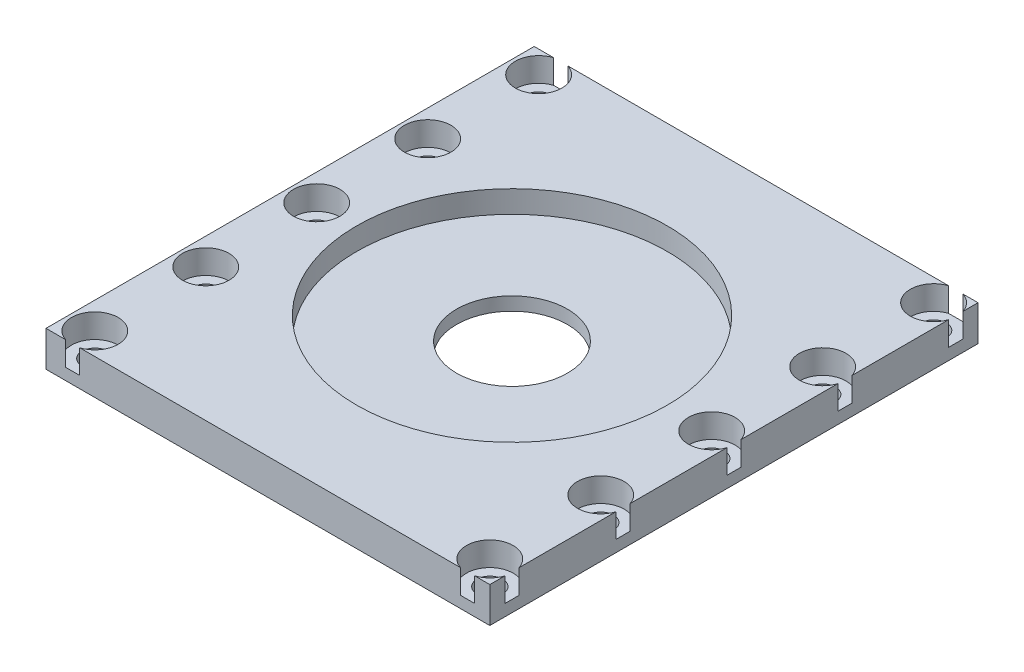
from build123d import *

# Parameters (mm, degrees)
SKETCH1_W                                           = 100
SKETCH1_H                                           = 110
BOSS_EXTRUDE1_DEPTH                                 = 8
CBORE_FOR_M5_HEX_SOCKET_HEAD_CAP_SCREW3_D           = 5.8
CBORE_FOR_M5_HEX_SOCKET_HEAD_CAP_SCREW3_DEPTH       = 8
CBORE_FOR_M5_HEX_SOCKET_HEAD_CAP_SCREW3_CBORE_D     = 10.5
CBORE_FOR_M5_HEX_SOCKET_HEAD_CAP_SCREW3_CBORE_DEPTH = 5.4
CBORE_FOR_M5_HEX_SOCKET_HEAD_CAP_SCREW3_TIP         = 1.742495795
F_25_0MM_DOWEL_HOLE1_D                              = 25
F_25_0MM_DOWEL_HOLE1_DEPTH                          = 10
F_25_0MM_DOWEL_HOLE1_TIP                            = 7.510757738
SKETCH7_R                                           = 35
CUT_EXTRUDE1_DEPTH                                  = 5


with BuildPart() as part:
    # Sketch1 → Boss-Extrude1 (new body)
    with BuildSketch(Plane(origin=(0, 0, 0), x_dir=(1, 0, 0), z_dir=(0, 1, 0))):
        with Locations((50, 55)):
            Rectangle(SKETCH1_W, SKETCH1_H)
    extrude(amount=BOSS_EXTRUDE1_DEPTH)

    # CBORE for M5 Hex Socket Head Cap Screw3
    with Locations(Plane(origin=(0, 8, 0), x_dir=(1, 0, 0), z_dir=(0, 1, 0))):
        with Locations((95, 105), (6, 105), (6, 80), (6, 55), (6, 30), (6, 5), (95, 55), (95, 30), (95, 5), (95, 80)):
            CounterBoreHole(CBORE_FOR_M5_HEX_SOCKET_HEAD_CAP_SCREW3_D / 2, CBORE_FOR_M5_HEX_SOCKET_HEAD_CAP_SCREW3_CBORE_D / 2, CBORE_FOR_M5_HEX_SOCKET_HEAD_CAP_SCREW3_CBORE_DEPTH, depth=CBORE_FOR_M5_HEX_SOCKET_HEAD_CAP_SCREW3_DEPTH)
            with Locations((0, 0, -(CBORE_FOR_M5_HEX_SOCKET_HEAD_CAP_SCREW3_DEPTH + CBORE_FOR_M5_HEX_SOCKET_HEAD_CAP_SCREW3_TIP / 2))):  # 118° drill point
                Cone(0, CBORE_FOR_M5_HEX_SOCKET_HEAD_CAP_SCREW3_D / 2, CBORE_FOR_M5_HEX_SOCKET_HEAD_CAP_SCREW3_TIP, mode=Mode.SUBTRACT)

    # Ø25.0mm Dowel Hole1
    with Locations(Plane(origin=(0, 8, 0), x_dir=(1, 0, 0), z_dir=(0, 1, 0))):
        with Locations((50, 55)):
            Hole(F_25_0MM_DOWEL_HOLE1_D / 2, depth=F_25_0MM_DOWEL_HOLE1_DEPTH)
            with Locations((0, 0, -(F_25_0MM_DOWEL_HOLE1_DEPTH + F_25_0MM_DOWEL_HOLE1_TIP / 2))):  # 118° drill point
                Cone(0, F_25_0MM_DOWEL_HOLE1_D / 2, F_25_0MM_DOWEL_HOLE1_TIP, mode=Mode.SUBTRACT)

    # Sketch7 → Cut-Extrude1 (cut)
    with BuildSketch(Plane(origin=(0, 8, 0), x_dir=(1, 0, 0), z_dir=(0, 1, 0))):
        with Locations((50, 55)):
            Circle(SKETCH7_R)
    extrude(amount=-CUT_EXTRUDE1_DEPTH, mode=Mode.SUBTRACT)


solid = part.part
